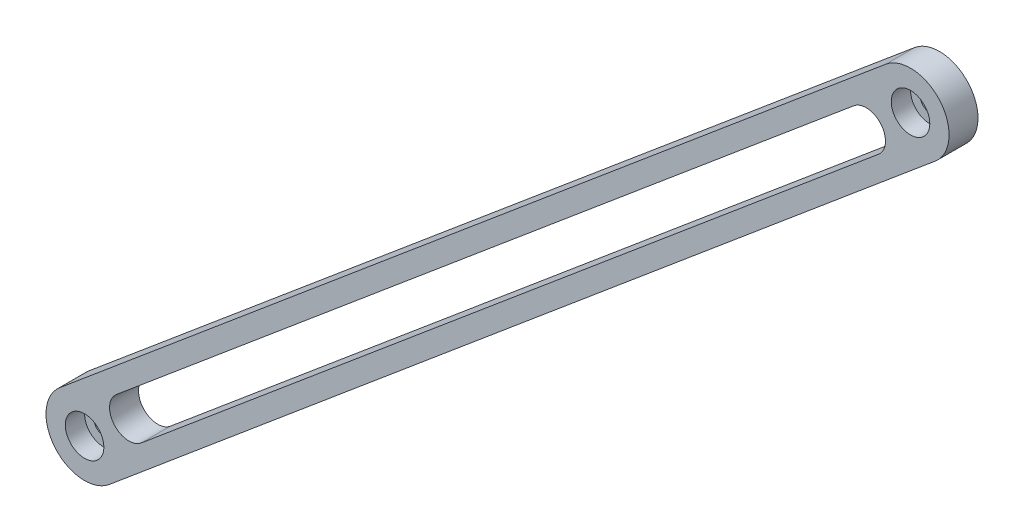
from build123d import *

# Parameters (mm, degrees)
SKETCH1_R           = 6.35
BOSS_EXTRUDE1_DEPTH = 19.05
SKETCH2_R           = 12.7
CUT_EXTRUDE1_DEPTH  = 12.7


with BuildPart() as part:
    # Sketch1 → Boss-Extrude1 (new body)
    with BuildSketch(Plane.XY):
        with BuildLine():
            Line((568.345160721, 503.256723569), (24.397466662, 46.830414104))
            ThreePointArc((24.397466662, 46.830414104), (21.266743093, 11.046079963), (57.051077234, 7.915356394))
            Line((57.051077234, 7.915356394), (600.998771294, 464.341665859))
            ThreePointArc((600.998771294, 464.341665859), (604.129494863, 500.126), (568.345160721, 503.256723569))
        make_face()
        with Locations((40.724271948, 27.372885249)):
            Circle(SKETCH1_R, mode=Mode.SUBTRACT)
        with Locations((584.671966007, 483.799194714)):
            Circle(SKETCH1_R, mode=Mode.SUBTRACT)
        with BuildLine():
            Line((563.649075368, 449.580222357), (78.073967874, 42.134328751))
            ThreePointArc((78.073967874, 42.134328751), (60.181800804, 43.699690535), (61.747162588, 61.591857606))
            Line((61.747162588, 61.591857606), (547.322270082, 469.037751213))
            ThreePointArc((547.322270082, 469.037751213), (565.214437152, 467.472389428), (563.649075368, 449.580222357))
        make_face(mode=Mode.SUBTRACT)
    extrude(amount=BOSS_EXTRUDE1_DEPTH)

    # Sketch2 → Cut-Extrude1 (cut)
    with BuildSketch(Plane.XY.offset(19.05)):
        with Locations((40.724271948, 27.372885249)):
            Circle(SKETCH2_R)
        with Locations((584.671966007, 483.799194714)):
            Circle(SKETCH2_R)
    extrude(amount=-CUT_EXTRUDE1_DEPTH, mode=Mode.SUBTRACT)


solid = part.part
